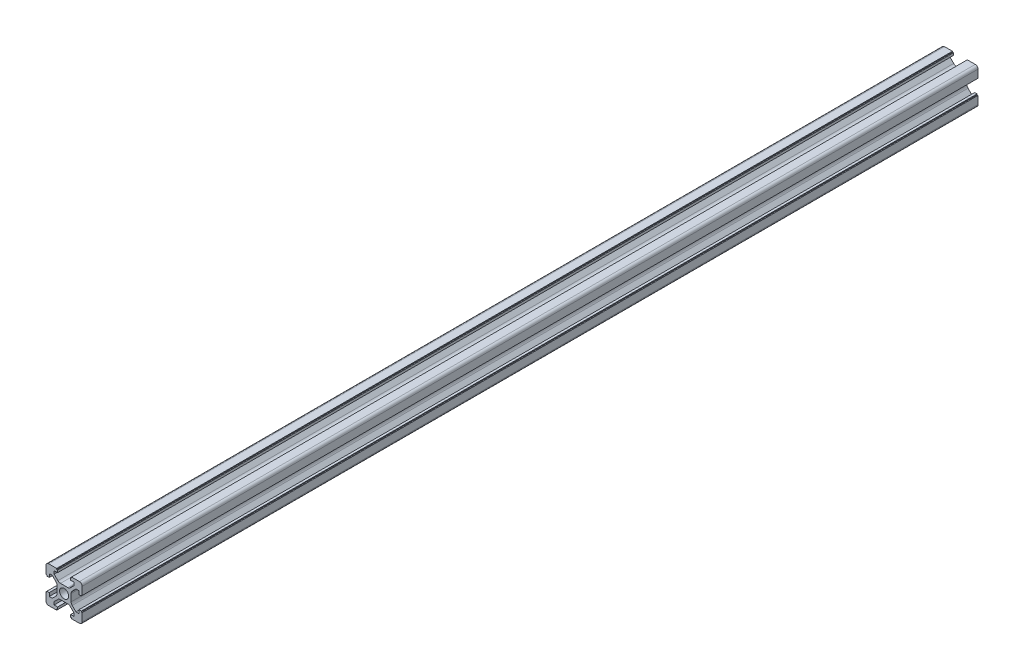
from build123d import *

# Parameters (mm, degrees)
SKETCH1_R           = 2.5
BOSS_EXTRUDE2_DEPTH = 495


with BuildPart() as part:
    # Sketch1 → Boss-Extrude2 (new body)
    with BuildSketch(Plane.XY):
        with BuildLine():
            Line((10, -8.5), (10, -4.1))
            Line((10, -4.1), (9.5, -4.1))
            Line((9.5, -4.1), (9.5, -3.6))
            Line((9.5, -3.6), (8.2, -3.6))
            Line((8.2, -3.6), (8.2, -5.5))
            Line((8.2, -5.5), (6.560660172, -5.5))
            Line((6.560660172, -5.5), (4.485786438, -3.425126266))
            ThreePointArc((4.485786438, -3.425126266), (4.052240935, -2.776279568), (3.9, -2.010912703))
            Line((3.9, -2.010912703), (3.9, 2.010912703))
            ThreePointArc((3.9, 2.010912703), (4.052240935, 2.776279568), (4.485786438, 3.425126266))
            Line((4.485786438, 3.425126266), (6.560660172, 5.5))
            Line((6.560660172, 5.5), (8.2, 5.5))
            Line((8.2, 5.5), (8.2, 3.6))
            Line((8.2, 3.6), (9.5, 3.6))
            Line((9.5, 3.6), (9.5, 4.1))
            Line((9.5, 4.1), (10, 4.1))
            Line((10, 4.1), (10, 8.5))
            ThreePointArc((10, 8.5), (9.560660172, 9.560660172), (8.5, 10))
            Line((8.5, 10), (4.1, 10))
            Line((4.1, 10), (4.1, 9.5))
            Line((4.1, 9.5), (3.6, 9.5))
            Line((3.6, 9.5), (3.6, 8.2))
            Line((3.6, 8.2), (5.5, 8.2))
            Line((5.5, 8.2), (5.5, 6.560660172))
            Line((5.5, 6.560660172), (3.425126266, 4.485786438))
            ThreePointArc((3.425126266, 4.485786438), (2.776279568, 4.052240935), (2.010912703, 3.9))
            Line((2.010912703, 3.9), (-2.010912703, 3.9))
            ThreePointArc((-2.010912703, 3.9), (-2.776279568, 4.052240935), (-3.425126266, 4.485786438))
            Line((-3.425126266, 4.485786438), (-5.5, 6.560660172))
            Line((-5.5, 6.560660172), (-5.5, 8.2))
            Line((-5.5, 8.2), (-3.6, 8.2))
            Line((-3.6, 8.2), (-3.6, 9.5))
            Line((-3.6, 9.5), (-4.1, 9.5))
            Line((-4.1, 9.5), (-4.1, 10))
            Line((-4.1, 10), (-8.5, 10))
            ThreePointArc((-8.5, 10), (-9.560660172, 9.560660172), (-10, 8.5))
            Line((-10, 8.5), (-10, 4.1))
            Line((-10, 4.1), (-9.5, 4.1))
            Line((-9.5, 4.1), (-9.5, 3.6))
            Line((-9.5, 3.6), (-8.2, 3.6))
            Line((-8.2, 3.6), (-8.2, 5.5))
            Line((-8.2, 5.5), (-6.560660172, 5.5))
            Line((-6.560660172, 5.5), (-4.485786438, 3.425126266))
            ThreePointArc((-4.485786438, 3.425126266), (-4.052240935, 2.776279568), (-3.9, 2.010912703))
            Line((-3.9, 2.010912703), (-3.9, -2.010912703))
            ThreePointArc((-3.9, -2.010912703), (-4.052240935, -2.776279568), (-4.485786438, -3.425126266))
            Line((-4.485786438, -3.425126266), (-6.560660172, -5.5))
            Line((-6.560660172, -5.5), (-8.2, -5.5))
            Line((-8.2, -5.5), (-8.2, -3.6))
            Line((-8.2, -3.6), (-9.5, -3.6))
            Line((-9.5, -3.6), (-9.5, -4.1))
            Line((-9.5, -4.1), (-10, -4.1))
            Line((-10, -4.1), (-10, -8.5))
            ThreePointArc((-10, -8.5), (-9.560660172, -9.560660172), (-8.5, -10))
            Line((-8.5, -10), (-4.1, -10))
            Line((-4.1, -10), (-4.1, -9.5))
            Line((-4.1, -9.5), (-3.6, -9.5))
            Line((-3.6, -9.5), (-3.6, -8.2))
            Line((-3.6, -8.2), (-5.5, -8.2))
            Line((-5.5, -8.2), (-5.5, -6.560660172))
            Line((-5.5, -6.560660172), (-3.425126266, -4.485786438))
            ThreePointArc((-3.425126266, -4.485786438), (-2.776279568, -4.052240935), (-2.010912703, -3.9))
            Line((-2.010912703, -3.9), (2.010912703, -3.9))
            ThreePointArc((2.010912703, -3.9), (2.776279568, -4.052240935), (3.425126266, -4.485786438))
            Line((3.425126266, -4.485786438), (5.5, -6.560660172))
            Line((5.5, -6.560660172), (5.5, -8.2))
            Line((5.5, -8.2), (3.6, -8.2))
            Line((3.6, -8.2), (3.6, -9.5))
            Line((3.6, -9.5), (4.1, -9.5))
            Line((4.1, -9.5), (4.1, -10))
            Line((4.1, -10), (8.5, -10))
            ThreePointArc((8.5, -10), (9.560660172, -9.560660172), (10, -8.5))
        make_face()
        Circle(SKETCH1_R, mode=Mode.SUBTRACT)
    extrude(amount=BOSS_EXTRUDE2_DEPTH)


solid = part.part
